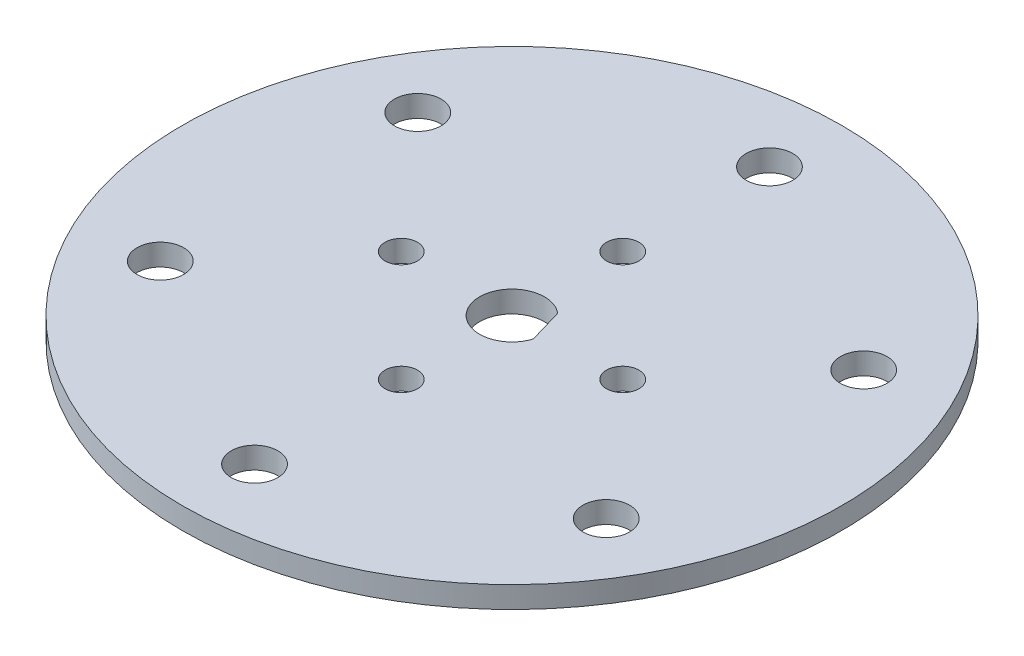
from build123d import *

# Parameters (mm, degrees)
SKETCH1_R           = 30.48
SKETCH1_R_2         = 2.15265
SKETCH1_R_3         = 1.5
BOSS_EXTRUDE1_DEPTH = 2
CUT_EXTRUDE1_DEPTH  = 10


with BuildPart() as part:
    # Sketch1 → Boss-Extrude1 (new body)
    with BuildSketch(Plane(origin=(0, 0, 0), x_dir=(1, 0, 0), z_dir=(0, 1, 0))):
        Circle(SKETCH1_R)
        with Locations((0, -23.8125)):
            Circle(SKETCH1_R_2, mode=Mode.SUBTRACT)
        with Locations((20.622229928, -11.90625)):
            Circle(SKETCH1_R_2, mode=Mode.SUBTRACT)
        with Locations((20.622229928, 11.90625)):
            Circle(SKETCH1_R_2, mode=Mode.SUBTRACT)
        with Locations((0, 23.8125)):
            Circle(SKETCH1_R_2, mode=Mode.SUBTRACT)
        with Locations((-20.622229928, 11.90625)):
            Circle(SKETCH1_R_2, mode=Mode.SUBTRACT)
        with Locations((-20.622229928, -11.90625)):
            Circle(SKETCH1_R_2, mode=Mode.SUBTRACT)
        with Locations((-10.240409902, 0)):
            Circle(SKETCH1_R_3, mode=Mode.SUBTRACT)
        with Locations((0, 10.240409902)):
            Circle(SKETCH1_R_3, mode=Mode.SUBTRACT)
        with Locations((10.240409902, 0)):
            Circle(SKETCH1_R_3, mode=Mode.SUBTRACT)
        with Locations((0, -10.240409902)):
            Circle(SKETCH1_R_3, mode=Mode.SUBTRACT)
    extrude(amount=BOSS_EXTRUDE1_DEPTH)

    # Sketch2 → Cut-Extrude1 (cut)
    with BuildSketch(Plane(origin=(0, 2, 0), x_dir=(1, 0, 0), z_dir=(0, 1, 0))):
        with BuildLine():
            ThreePointArc((1.93204455, 2.295038966), (-2.879237228, -0.842610814), (2.864533851, -0.8913169))
            Line((2.864533851, -0.8913169), (1.93204455, 2.295038966))
        make_face()
    extrude(amount=-CUT_EXTRUDE1_DEPTH, mode=Mode.SUBTRACT)


solid = part.part
